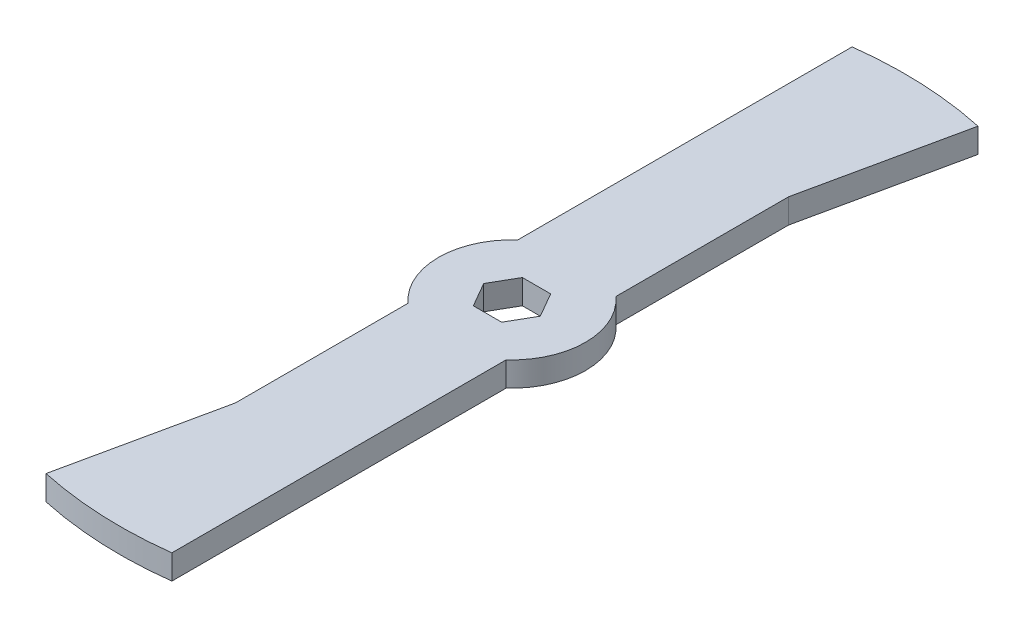
from build123d import *

# Parameters (mm, degrees)
BOSS_EXTRUDE1_DEPTH = 6.35
CUT_EXTRUDE2_REACH  = 106.021


with BuildPart() as part:
    # Sketch1 → Boss-Extrude1 (new body)
    with BuildSketch(Plane(origin=(0, 0, 0), x_dir=(1, 0, 0), z_dir=(0, 1, 0))):
        with BuildLine():
            ThreePointArc((21.389473684, 99.322960163), (4.407318933, 101.504362171), (-12.7, 100.803124952))
            Line((-12.7, 100.803124952), (-12.7, 14.199031657))
            ThreePointArc((-12.7, 14.199031657), (-19.05, 0), (-12.7, -14.199031657))
            Line((-12.7, -14.199031657), (-12.7, -58.973007597))
            Line((-12.7, -58.973007597), (-21.389473684, -99.322960163))
            ThreePointArc((-21.389473684, -99.322960163), (-4.407318933, -101.504362171), (12.7, -100.803124952))
            Line((12.7, -100.803124952), (12.7, -14.199031657))
            ThreePointArc((12.7, -14.199031657), (19.05, 0), (12.7, 14.199031657))
            Line((12.7, 14.199031657), (12.7, 58.973007597))
            Line((12.7, 58.973007597), (21.389473684, 99.322960163))
        make_face()
    extrude(amount=BOSS_EXTRUDE1_DEPTH)

    # Sketch3 → Cut-Extrude2 (cut, up to next)
    with BuildSketch(Plane(origin=(0, 6.35, 0), x_dir=(1, 0, 0), z_dir=(0, 1, 0)), mode=Mode.PRIVATE) as cut_extrude2_sk1:
        Polygon((7.332348419, 0), (3.666174209, 6.35), (-3.666174209, 6.35), (-7.332348419, 0), (-3.666174209, -6.35), (3.666174209, -6.35), align=None)
    cut_extrude2_tool1 = extrude(cut_extrude2_sk1.sketch, amount=-CUT_EXTRUDE2_REACH, mode=Mode.PRIVATE) & part.part
    add(cut_extrude2_tool1.solids().sort_by_distance((0, 6.35, 0))[0], mode=Mode.SUBTRACT)


solid = part.part
